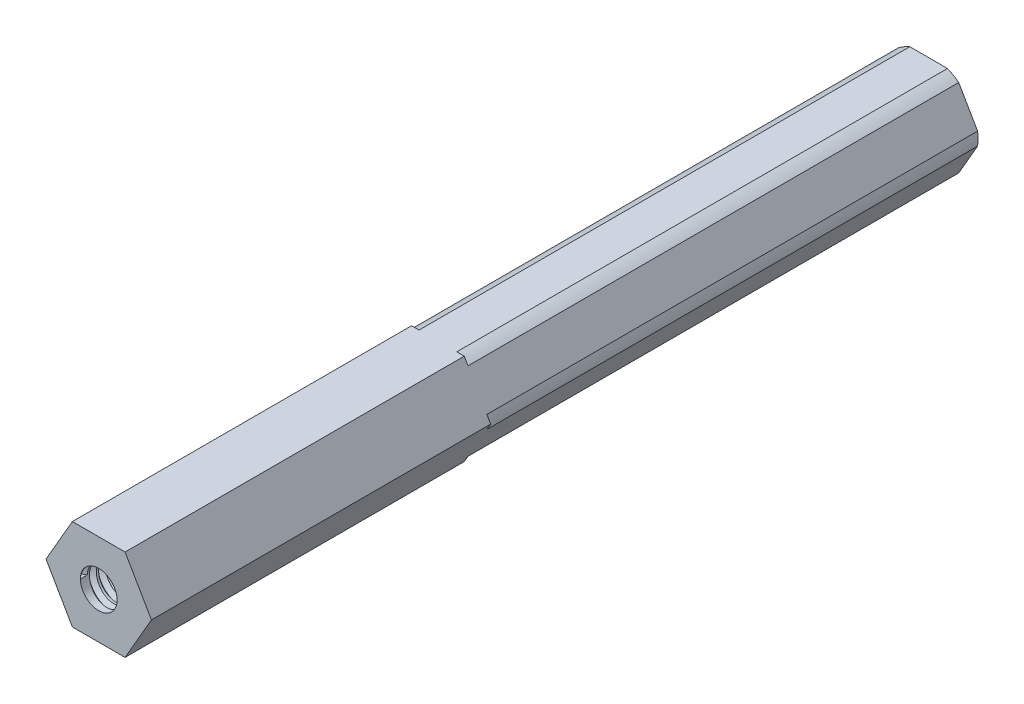
from build123d import *
from build123d.topology import SkipClean

# Parameters (mm, degrees)
EXTRUSI_N_HEX_PROFILE_DEPTH = 57.7088
TAP_START                   = 57.7088
CROQUIS3_R                  = 2.5527
TAP_HOLE_1_DEPTH            = 19.05
TAP_START_2                 = -38.6588
CROQUIS3_3_R                = 2.5527
TAP_HOLE_2_DEPTH            = 19.05
THUNDERHEX_START            = -57.7088
CROQUIS7_OUTSIDE_W          = 40.072
CROQUIS7_OUTSIDE_H          = 38.108
CROQUIS7_OUTSIDE_R          = 6.8707
THUNDERHEX_DEPTH            = 68.2498
ROSCA1_PITCH                = 1.27
ROSCA2_PITCH                = 1.27


with BuildPart() as part:
    # Croquis2 → Extrusión Hex Profile (new, symmetric)
    with BuildSketch(Plane.XY):
        Polygon((3.666174209, -6.35), (7.332348419, 0), (3.666174209, 6.35), (-3.666174209, 6.35), (-7.332348419, 0), (-3.666174209, -6.35), align=None)
    extrude(amount=EXTRUSI_N_HEX_PROFILE_DEPTH, both=True)

    # Croquis3 → Tap Hole 1 (cut)
    with BuildSketch(Plane.XY.offset(TAP_START)):
        Circle(CROQUIS3_R)
    extrude(amount=-TAP_HOLE_1_DEPTH, mode=Mode.SUBTRACT)

    # Croquis3<3> → Tap Hole 2 (cut)
    with BuildSketch(Plane.XY.offset(TAP_START_2)):
        Circle(CROQUIS3_3_R)
    extrude(amount=-TAP_HOLE_2_DEPTH, mode=Mode.SUBTRACT)

    # Croquis7 outside → ThunderHex (cut)
    with BuildSketch(Plane.XY.offset(THUNDERHEX_START)):
        Rectangle(CROQUIS7_OUTSIDE_W, CROQUIS7_OUTSIDE_H)
        Circle(CROQUIS7_OUTSIDE_R, mode=Mode.SUBTRACT)
    extrude(amount=THUNDERHEX_DEPTH, mode=Mode.SUBTRACT)

    # Rosca1: the profile of Perfil de rosca1 profile screwed along a right-hand helix of 15 turns, 8 arcs to a turn; built about Z, then put on its axis
    with SkipClean():  # the faces are left unmerged after this step: merging them gives an invalid solid
        rosca1_z = Axis((0, 0, 0), (0, 0, 1))
        rosca1_corners = [(2.5524, 0, -0.000173205), (3.240107661, 0, 0.396874998), (3.240107661, 0, 0.555624998), (2.5524, 0, 0.952673202)]
        with BuildLine(mode=Mode.PRIVATE) as rosca1_profile:
            Line(rosca1_corners[0], rosca1_corners[1])
            Line(rosca1_corners[1], rosca1_corners[2])
            Line(rosca1_corners[2], rosca1_corners[3])
            Line(rosca1_corners[3], rosca1_corners[0])
        rosca1_cap = Face(rosca1_profile.wire())
        rosca1_turn_angles = [0, 22.5, 45, 67.5, 90, 112.5, 135, 157.5, 180, 202.5, 225, 247.5, 270, 292.5, 315, 337.5, 360]
        rosca1_turn_weights = [1, 0.9238795325112867, 1, 0.9238795325112867, 1, 0.9238795325112867, 1, 0.9238795325112867, 1, 0.9238795325112867, 1, 0.9238795325112867, 1, 0.9238795325112867, 1, 0.9238795325112867, 1]
        rosca1_turn_rails = [Edge.make_bspline([Vector(p[0], p[1], 0).rotate(rosca1_z, rosca1_turn_angles[k]) / rosca1_turn_weights[k] + Vector(0, 0, p[2] + ROSCA1_PITCH * rosca1_turn_angles[k] / 360) for k in range(17)], [0, 0, 0, 1, 1, 2, 2, 3, 3, 4, 4, 5, 5, 6, 6, 7, 7, 8, 8, 8], 2, rosca1_turn_weights) for p in rosca1_corners]
        rosca1_turn_sides = [Face.make_surface_from_curves(rosca1_turn_rails[p[0]], rosca1_turn_rails[p[1]]) for p in [(0, 1), (1, 2), (2, 3), (3, 0)]]
        rosca1 = Plane(origin=(0, 0, 57.7088), x_dir=(-1, 0, 0), z_dir=(0, 0, -1)) * Solid(Shell([*[p.moved(Location((0, 0, ROSCA1_PITCH * i))) for i in range(15) for p in rosca1_turn_sides], rosca1_cap, rosca1_cap.rotate(rosca1_z, 5400).moved(Location((0, 0, ROSCA1_PITCH * 5400 / 360)))]))
        add(rosca1, mode=Mode.SUBTRACT)

    # Rosca2: the profile of Perfil de rosca2 profile screwed along a right-hand helix of 15 turns, 8 arcs to a turn; built about Z, then put on its axis
    with SkipClean():  # the faces are left unmerged after this step: merging them gives an invalid solid
        rosca2_z = Axis((0, 0, 0), (0, 0, 1))
        rosca2_corners = [(2.5524, 0, -0.000173205), (3.240107661, 0, 0.396874998), (3.240107661, 0, 0.555624998), (2.5524, 0, 0.952673202)]
        with BuildLine(mode=Mode.PRIVATE) as rosca2_profile:
            Line(rosca2_corners[0], rosca2_corners[1])
            Line(rosca2_corners[1], rosca2_corners[2])
            Line(rosca2_corners[2], rosca2_corners[3])
            Line(rosca2_corners[3], rosca2_corners[0])
        rosca2_cap = Face(rosca2_profile.wire())
        rosca2_turn_angles = [0, 22.5, 45, 67.5, 90, 112.5, 135, 157.5, 180, 202.5, 225, 247.5, 270, 292.5, 315, 337.5, 360]
        rosca2_turn_weights = [1, 0.9238795325112867, 1, 0.9238795325112867, 1, 0.9238795325112867, 1, 0.9238795325112867, 1, 0.9238795325112867, 1, 0.9238795325112867, 1, 0.9238795325112867, 1, 0.9238795325112867, 1]
        rosca2_turn_rails = [Edge.make_bspline([Vector(p[0], p[1], 0).rotate(rosca2_z, rosca2_turn_angles[k]) / rosca2_turn_weights[k] + Vector(0, 0, p[2] + ROSCA2_PITCH * rosca2_turn_angles[k] / 360) for k in range(17)], [0, 0, 0, 1, 1, 2, 2, 3, 3, 4, 4, 5, 5, 6, 6, 7, 7, 8, 8, 8], 2, rosca2_turn_weights) for p in rosca2_corners]
        rosca2_turn_sides = [Face.make_surface_from_curves(rosca2_turn_rails[p[0]], rosca2_turn_rails[p[1]]) for p in [(0, 1), (1, 2), (2, 3), (3, 0)]]
        rosca2 = Plane(origin=(0, 0, -57.7088), x_dir=(1, 0, 0), z_dir=(0, 0, 1)) * Solid(Shell([*[p.moved(Location((0, 0, ROSCA2_PITCH * i))) for i in range(15) for p in rosca2_turn_sides], rosca2_cap, rosca2_cap.rotate(rosca2_z, 5400).moved(Location((0, 0, ROSCA2_PITCH * 5400 / 360)))]))
        add(rosca2, mode=Mode.SUBTRACT)


solid = part.part
